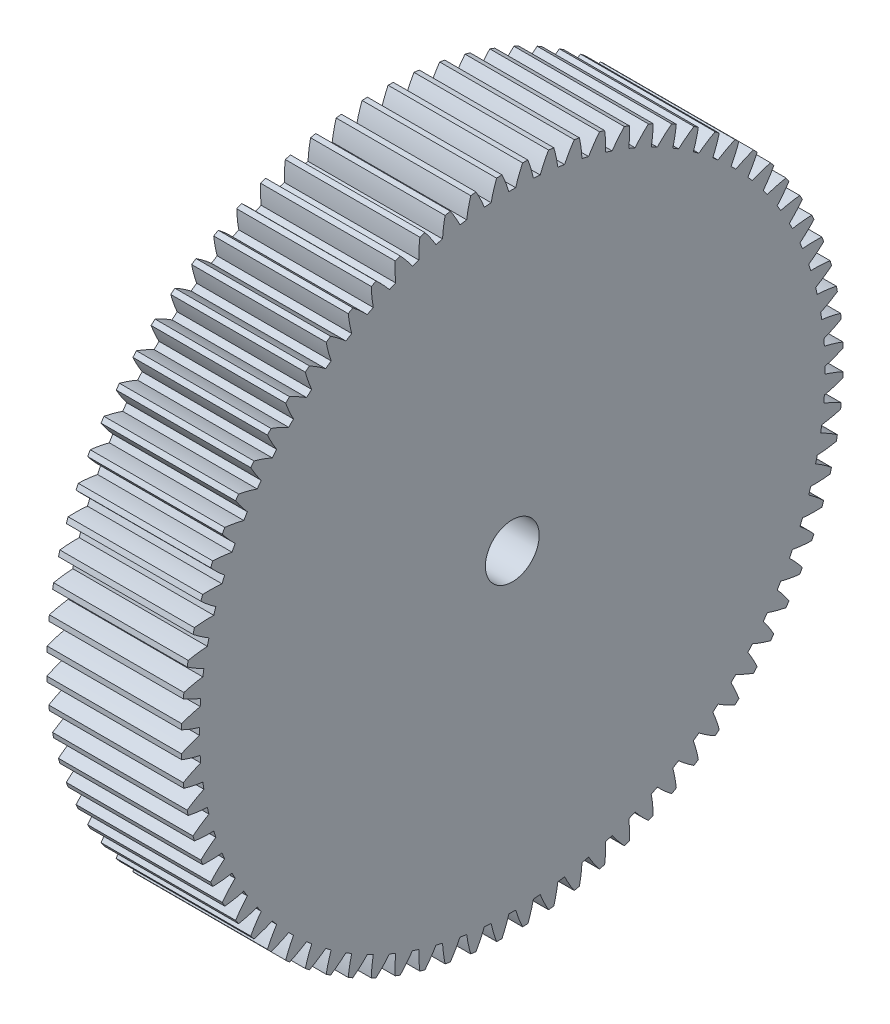
from build123d import *

# Parameters (mm, degrees)
BASPROSKE_W     = 10
BASPROSKE_H     = 24.6
TOOTHCUT_DEPTH  = 37.198342503
TEETHCUTS_COUNT = 80
TEETHCUTS_ANGLE = 355.5
BORSKE_R        = 2
BORE_DEPTH      = 50.0000508


with BuildPart() as part:
    # BasProSke → Base-Revolve (revolve)
    with BuildSketch(Plane(origin=(0, 0, 0), x_dir=(1, 0, 0), z_dir=(0, 1, 0))):
        with Locations((5, 12.3)):
            Rectangle(BASPROSKE_W, BASPROSKE_H)
    revolve(axis=Axis((-10, 0, 0), (1, 0, 0)))

    # TooCutSke → ToothCut (cut, through all)
    with BuildSketch(Plane(origin=(0, 0, 0), x_dir=(0, 0, -1), z_dir=(1, 0, 0))):
        with BuildLine():
            ThreePointArc((0.252552306, 23.24762823), (0, 23.249), (-0.252552306, 23.24762823))
            ThreePointArc((-0.252552306, 23.24762823), (-0.490342662, 23.940404843), (-0.780259152, 24.613035587))
            ThreePointArc((-0.780259152, 24.613035587), (0, 24.6254), (0.780259152, 24.613035587))
            ThreePointArc((0.780259152, 24.613035587), (0.490342662, 23.940404843), (0.252552306, 23.24762823))
        make_face()
    toothcut = extrude(amount=TOOTHCUT_DEPTH, mode=Mode.SUBTRACT)

    # TeethCuts: ToothCut ×80 about axis
    teethcuts_axis = Axis((-10, 0, 0), (1, 0, 0))
    for i in range(1, TEETHCUTS_COUNT):
        add(toothcut.rotate(teethcuts_axis, i * TEETHCUTS_ANGLE / (TEETHCUTS_COUNT - 1)), mode=Mode.SUBTRACT)

    # BorSke → Bore (cut, symmetric)
    with BuildSketch(Plane(origin=(0, 0, 0), x_dir=(0, 0, -1), z_dir=(1, 0, 0))):
        Circle(BORSKE_R)
    extrude(amount=BORE_DEPTH, both=True, mode=Mode.SUBTRACT)


solid = part.part
